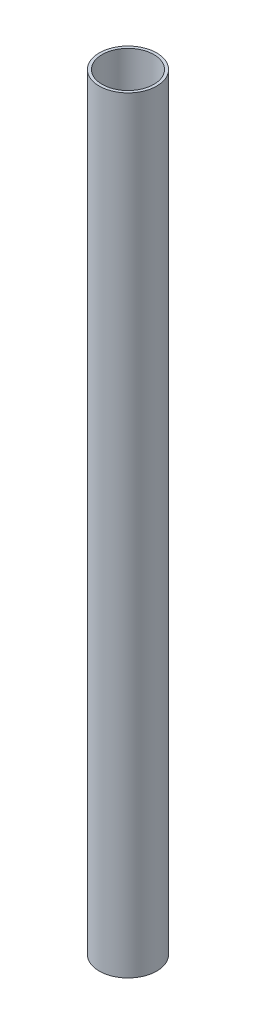
from build123d import *

# Parameters (mm, degrees)
SKETCH1_R           = 15
SKETCH1_R_2         = 13.5
BOSS_EXTRUDE1_DEPTH = 400


with BuildPart() as part:
    # Sketch1 → Boss-Extrude1 (new body)
    with BuildSketch(Plane(origin=(0, 0, 0), x_dir=(1, 0, 0), z_dir=(0, 1, 0))):
        Circle(SKETCH1_R)
        Circle(SKETCH1_R_2, mode=Mode.SUBTRACT)
    extrude(amount=BOSS_EXTRUDE1_DEPTH)


solid = part.part
